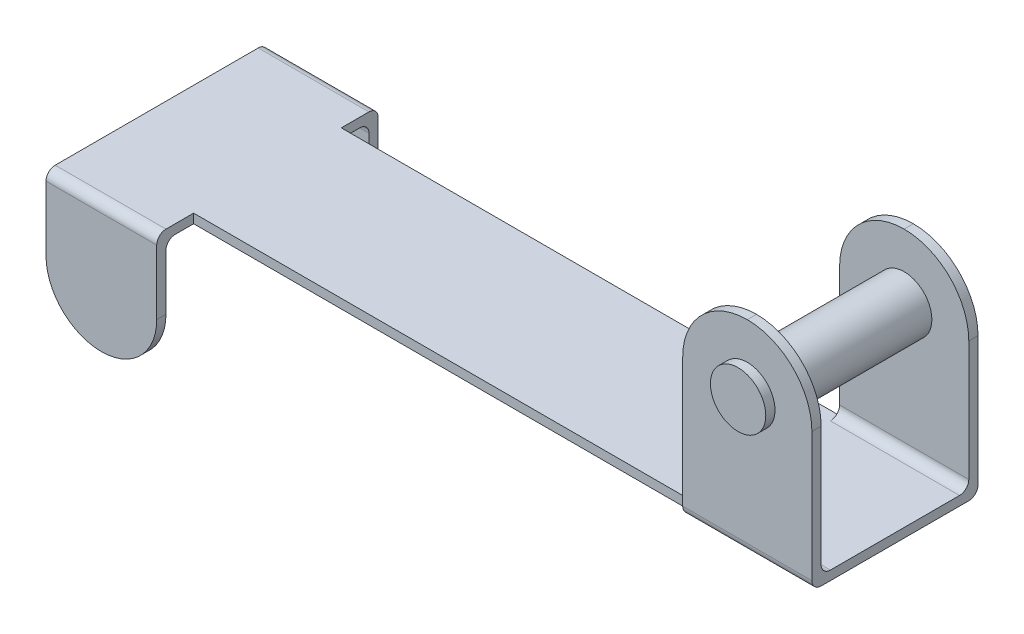
from build123d import *

# Parameters (mm, degrees)
SKETCH1_W           = 20
SKETCH1_H           = 0.25
BOSS_EXTRUDE1_DEPTH = 2
SKETCH2_W           = 0.25
SKETCH2_H           = 5.5
BOSS_EXTRUDE2_DEPTH = 3.5
FILLET1_R           = 0.25
FILLET2_R           = 1.75
BOSS_EXTRUDE3_START = -2.25
SKETCH3_R           = 0.75
BOSS_EXTRUDE3_DEPTH = 2.5
BOSS_EXTRUDE5_DEPTH = 3
FILLET3_R           = 1.5
FILLET4_R           = 0.25


with BuildPart() as part:
    # Sketch1 → Boss-Extrude1 (new, symmetric)
    with BuildSketch(Plane.XY):
        Rectangle(SKETCH1_W, SKETCH1_H)
    extrude(amount=BOSS_EXTRUDE1_DEPTH, both=True)

    # Sketch2 → Boss-Extrude2 (add)
    with BuildSketch(Plane(origin=(10, 0, 0), x_dir=(0, 0, -1), z_dir=(1, 0, 0))):
        with Locations((-2.125, 2.625)):
            Rectangle(SKETCH2_W, SKETCH2_H)
        with Locations((2.125, 2.625)):
            Rectangle(SKETCH2_W, SKETCH2_H)
    extrude(amount=-BOSS_EXTRUDE2_DEPTH)

    # Fillet1
    fillet1_edges = [part.edges().sort_by_distance(p)[0] for p in [
        (8.25, -0.125, -2.25),
        (8.25, -0.125, 2.25),
        (8.25, 0.125, -2),
        (8.25, 0.125, 2),
    ]]
    fillet(fillet1_edges, radius=FILLET1_R)

    # Fillet2
    fillet2_edges = [part.edges().sort_by_distance(p)[0] for p in [
        (10, 5.375, -2.125),
        (6.5, 5.375, -2.125),
        (6.5, 5.375, 2.125),
        (10, 5.375, 2.125),
    ]]
    fillet(fillet2_edges, radius=FILLET2_R - 0.0001)  # a hair under: the kernel refuses the full size

    # Sketch3 → Boss-Extrude3 (add, symmetric)
    with BuildSketch(Plane.XY.offset(2.25).offset(BOSS_EXTRUDE3_START)):
        with Locations(Location((8.25, 3.625, 0), (0, 0, 180))):
            Circle(SKETCH3_R)
    extrude(amount=BOSS_EXTRUDE3_DEPTH, both=True)

    # Sketch5 → Boss-Extrude5 (add)
    with BuildSketch(Plane.ZY.offset(10)):
        Polygon((-2, -0.125), (-2.75, -0.125), (-2.75, -3.375), (-3, -3.375), (-3, 0.125), (-2, 0.125), align=None)
        Polygon((3, 0.125), (2, 0.125), (2, -0.125), (2.75, -0.125), (2.75, -3.375), (3, -3.375), align=None)
    extrude(amount=-BOSS_EXTRUDE5_DEPTH)

    # Fillet3
    fillet3_edges = [part.edges().sort_by_distance(p)[0] for p in [
        (-10, -3.375, 2.875),
        (-7, -3.375, 2.875),
        (-7, -3.375, -2.875),
        (-10, -3.375, -2.875),
    ]]
    fillet(fillet3_edges, radius=FILLET3_R - 0.0001)  # a hair under: the kernel refuses the full size

    # Fillet4
    fillet4_edges = [part.edges().sort_by_distance(p)[0] for p in [
        (-8.5, -0.125, -2.75),
        (-8.5, 0.125, -3),
        (-8.5, 0.125, 3),
        (-8.5, -0.125, 2.75),
    ]]
    fillet(fillet4_edges, radius=FILLET4_R)


solid = part.part
